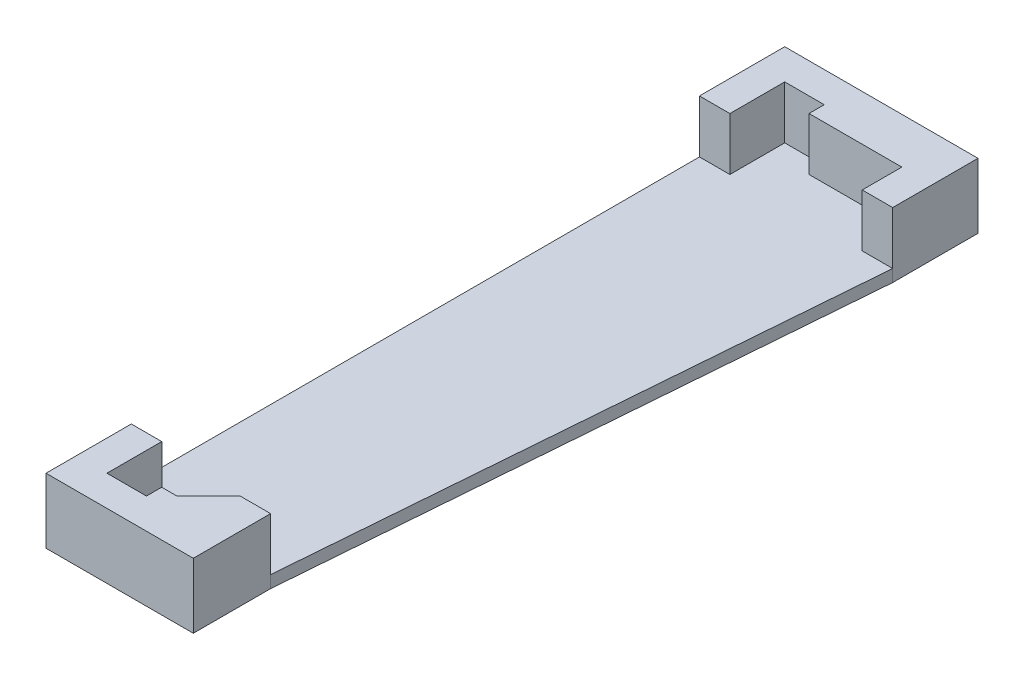
from build123d import *

# Parameters (mm, degrees)
SKETCH1_W           = 40.287448
SKETCH1_H           = 153.9875
BOSS_EXTRUDE1_DEPTH = 2.54
BOSS_EXTRUDE2_DEPTH = 11.006666667
CUT_EXTRUDE1_DEPTH  = 160.550554758


with BuildPart() as part:
    # Sketch1 → Boss-Extrude1 (new body)
    with BuildSketch(Plane(origin=(0, 0, 0), x_dir=(1, 0, 0), z_dir=(0, 1, 0))):
        with Locations((20.143724, 76.99375)):
            Rectangle(SKETCH1_W, SKETCH1_H)
    extrude(amount=BOSS_EXTRUDE1_DEPTH)

    # Sketch3 → Boss-Extrude2 (add)
    with BuildSketch(Plane(origin=(0, 2.54, 0), x_dir=(1, 0, 0), z_dir=(0, 1, 0))):
        Polygon((6.35, 147.6375), (14.5875, 147.6375), (14.5875, 144.4625), (33.9375, 144.4625), (33.9375, 136.2075), (40.2875, 136.2075), (40.2875, 153.9875), (0, 153.9875), (0, 136.2075), (6.35, 136.2075), align=None)
        Polygon((17.7625, 9.525), (14.5875, 9.525), (14.5875, 6.35), (6.35, 6.35), (6.35, 17.78), (0, 17.78), (0, 0), (30.703239638, 0), (30.703239638, 16.115739638), (24.353239638, 16.115739638), align=None)
    extrude(amount=BOSS_EXTRUDE2_DEPTH)

    # Sketch4 → Cut-Extrude1 (cut, through all)
    with BuildSketch(Plane(origin=(0, 2.54, 0), x_dir=(1, 0, 0), z_dir=(0, 1, 0))):
        Polygon((30.703239638, 0), (40.287448, 0), (40.287448, 136.2075), (30.703239638, 16.115739638), align=None)
    extrude(amount=-CUT_EXTRUDE1_DEPTH, mode=Mode.SUBTRACT)


solid = part.part
